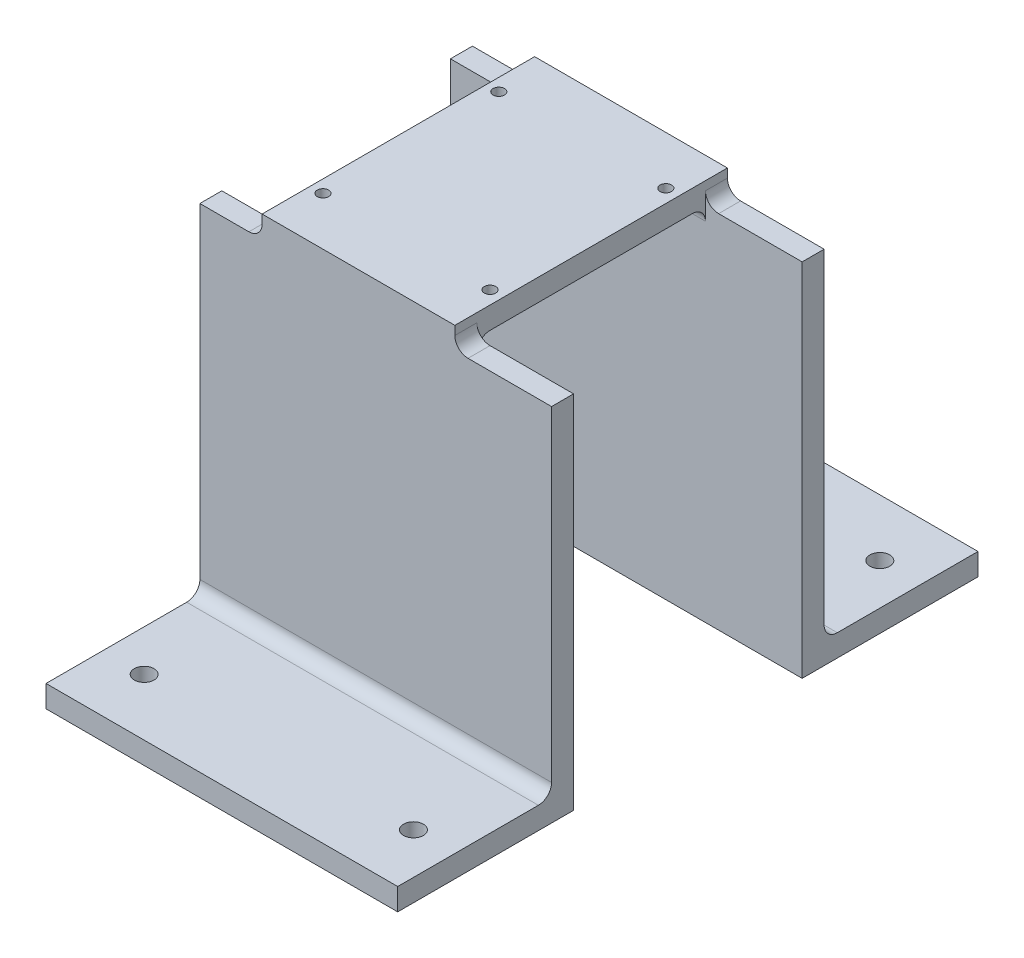
from build123d import *

# Parameters (mm, degrees)
SKETCH1_W             = 80
SKETCH1_H             = 40
SKETCH1_R             = 2.25
BOSS_EXTRUDE1_DEPTH   = 5
BOSS_EXTRUDE1_2_DEPTH = 5
SKETCH2_W             = 80
SKETCH2_H             = 5
BOSS_EXTRUDE2_DEPTH   = 77.05
SKETCH3_W             = 43.85
SKETCH3_H             = 62
BOSS_EXTRUDE3_DEPTH   = 5
CUT_EXTRUDE1_REACH    = 118.334
SKETCH4_R             = 1.3
FILLET1_R             = 3
FILLET2_R             = 3


with BuildPart() as part:
    # Sketch1 → Boss-Extrude1 (new body)
    with BuildSketch(Plane(origin=(0, 0, 0), x_dir=(1, 0, 0), z_dir=(0, 1, 0))):
        with Locations((0, 46)):
            Rectangle(SKETCH1_W, SKETCH1_H)
        with Locations((-30.625, 53.044055982)):
            Circle(SKETCH1_R, mode=Mode.SUBTRACT)
        with Locations((30.625, 53.044055982)):
            Circle(SKETCH1_R, mode=Mode.SUBTRACT)
    extrude(amount=BOSS_EXTRUDE1_DEPTH)



with BuildPart() as body_2:
    # Sketch1 → Boss-Extrude1 2 (new body)
    with BuildSketch(Plane(origin=(0, 0, 0), x_dir=(1, 0, 0), z_dir=(0, 1, 0))):
        with Locations((0, -46)):
            Rectangle(SKETCH1_W, SKETCH1_H)
        with Locations((30.625, -53.044055982)):
            Circle(SKETCH1_R, mode=Mode.SUBTRACT)
        with Locations((-30.625, -53.044055982)):
            Circle(SKETCH1_R, mode=Mode.SUBTRACT)
    extrude(amount=BOSS_EXTRUDE1_2_DEPTH)


with BuildPart() as part_1:
    add(part.part)

    add(body_2.part)  # Boss-Extrude2 merges body 2
    # Sketch2 → Boss-Extrude2 (add)
    with BuildSketch(Plane(origin=(0, 5, 0), x_dir=(1, 0, 0), z_dir=(0, 1, 0))):
        with Locations((0, 28.5)):
            Rectangle(SKETCH2_W, SKETCH2_H)
        with Locations((0, -28.5)):
            Rectangle(SKETCH2_W, SKETCH2_H)
    extrude(amount=BOSS_EXTRUDE2_DEPTH)

    # Sketch3 → Boss-Extrude3 (add)
    with BuildSketch(Plane(origin=(0, 82.05, 0), x_dir=(1, 0, 0), z_dir=(0, 1, 0))):
        with Locations((-3.925, 0)):
            Rectangle(SKETCH3_W, SKETCH3_H)
    extrude(amount=BOSS_EXTRUDE3_DEPTH)

    # Sketch4 → Cut-Extrude1 (cut, up to next)
    with BuildSketch(Plane(origin=(0, 87.05, 0), x_dir=(1, 0, 0), z_dir=(0, 1, 0)), mode=Mode.PRIVATE) as cut_extrude1_sk1:
        with Locations((-23, 20)):
            Circle(SKETCH4_R)
    cut_extrude1_tool1 = extrude(cut_extrude1_sk1.sketch, amount=-CUT_EXTRUDE1_REACH, mode=Mode.PRIVATE) & part_1.part
    # Sketch4 → Cut-Extrude1 (cut, up to next)
    with BuildSketch(Plane(origin=(0, 87.05, 0), x_dir=(1, 0, 0), z_dir=(0, 1, 0)), mode=Mode.PRIVATE) as cut_extrude1_sk2:
        with Locations((15, 20)):
            Circle(SKETCH4_R)
    cut_extrude1_tool2 = extrude(cut_extrude1_sk2.sketch, amount=-CUT_EXTRUDE1_REACH, mode=Mode.PRIVATE) & part_1.part
    # Sketch4 → Cut-Extrude1 (cut, up to next)
    with BuildSketch(Plane(origin=(0, 87.05, 0), x_dir=(1, 0, 0), z_dir=(0, 1, 0)), mode=Mode.PRIVATE) as cut_extrude1_sk3:
        with Locations((15, -20)):
            Circle(SKETCH4_R)
    cut_extrude1_tool3 = extrude(cut_extrude1_sk3.sketch, amount=-CUT_EXTRUDE1_REACH, mode=Mode.PRIVATE) & part_1.part
    # Sketch4 → Cut-Extrude1 (cut, up to next)
    with BuildSketch(Plane(origin=(0, 87.05, 0), x_dir=(1, 0, 0), z_dir=(0, 1, 0)), mode=Mode.PRIVATE) as cut_extrude1_sk4:
        with Locations((-23, -20)):
            Circle(SKETCH4_R)
    cut_extrude1_tool4 = extrude(cut_extrude1_sk4.sketch, amount=-CUT_EXTRUDE1_REACH, mode=Mode.PRIVATE) & part_1.part
    add(cut_extrude1_tool1.solids().sort_by_distance((-23, 87.05, -20))[0], mode=Mode.SUBTRACT)
    add(cut_extrude1_tool2.solids().sort_by_distance((15, 87.05, -20))[0], mode=Mode.SUBTRACT)
    add(cut_extrude1_tool3.solids().sort_by_distance((15, 87.05, 20))[0], mode=Mode.SUBTRACT)
    add(cut_extrude1_tool4.solids().sort_by_distance((-23, 87.05, 20))[0], mode=Mode.SUBTRACT)

    # Fillet1
    fillet1_edges = [part_1.edges().sort_by_distance(p)[0] for p in [
        (-3.925, 82.05, -26),
        (-3.925, 82.05, 26),
        (0, 5, -31),
        (0, 5, 31),
    ]]
    fillet(fillet1_edges, radius=FILLET1_R)

    # Fillet2
    fillet2_edges = [part_1.edges().sort_by_distance(p)[0] for p in [
        (18, 82.05, -28.5),
        (-25.85, 82.05, -28.5),
        (-25.85, 82.05, 28.5),
        (18, 82.05, 28.5),
    ]]
    fillet(fillet2_edges, radius=FILLET2_R)


solid = part_1.part
